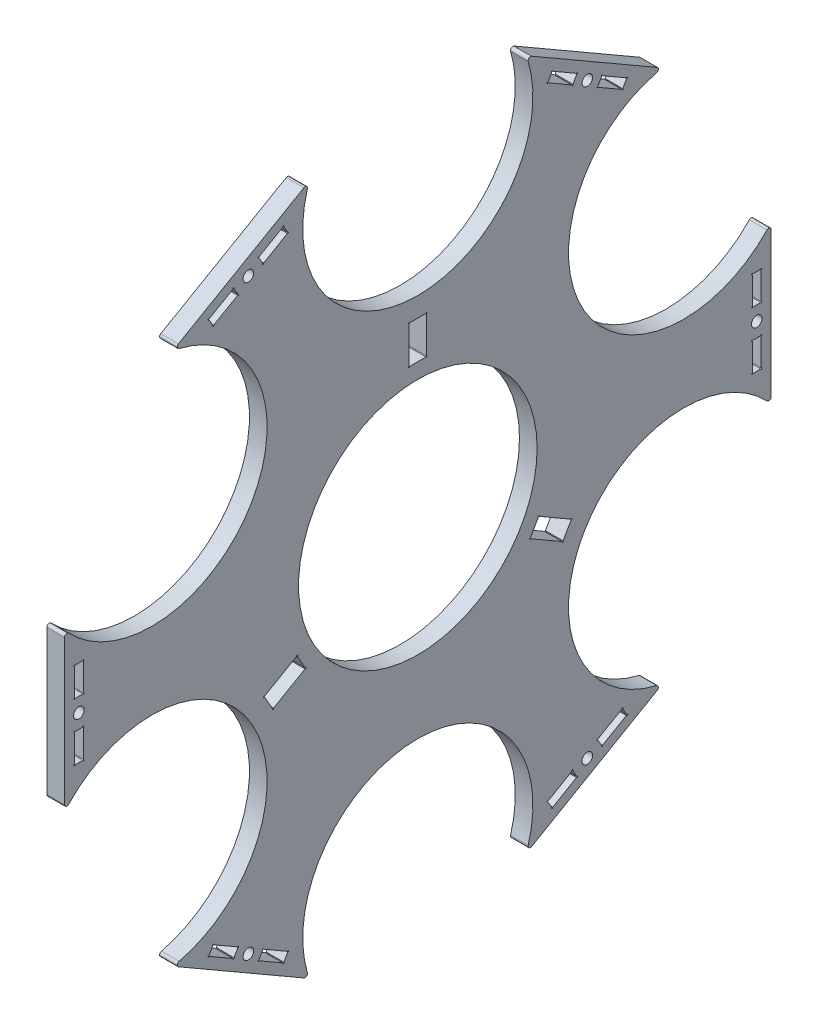
from build123d import *

# Parameters (mm, degrees)
SKETCH2_R           = 39.487475
BOSS_EXTRUDE1_DEPTH = 5.842
FILLET1_R           = 0.79375
SKETCH4_W           = 5.742
SKETCH4_H           = 12.5
CUT_EXTRUDE3_DEPTH  = 163.986308211
SKETCH5_R           = 0.1984375
CUT_EXTRUDE4_DEPTH  = 163.986308211
SKETCH6_R           = 1.7526
CUT_EXTRUDE5_DEPTH  = 163.986308211


with BuildPart() as part:
    # Sketch2 → Boss-Extrude1 (new body)
    with BuildSketch(Plane(origin=(0, 0, 0), x_dir=(0, 0, -1), z_dir=(1, 0, 0))):
        with BuildLine():
            ThreePointArc((116.947215895, 26.041480267), (54.99261314, 31.75), (81.02619141, 88.258519733))
            Line((81.02619141, 88.258519733), (35.921024484, 114.3))
            ThreePointArc((35.921024484, 114.3), (0, 63.5), (-35.921024484, 114.3))
            Line((-35.921024484, 114.3), (-81.02619141, 88.258519733))
            ThreePointArc((-81.02619141, 88.258519733), (-54.99261314, 31.75), (-116.947215895, 26.041480267))
            Line((-116.947215895, 26.041480267), (-116.947215895, -26.041480267))
            ThreePointArc((-116.947215895, -26.041480267), (-54.99261314, -31.75), (-81.02619141, -88.258519733))
            Line((-81.02619141, -88.258519733), (-35.921024484, -114.3))
            ThreePointArc((-35.921024484, -114.3), (0, -63.5), (35.921024484, -114.3))
            Line((35.921024484, -114.3), (81.02619141, -88.258519733))
            ThreePointArc((81.02619141, -88.258519733), (54.99261314, -31.75), (116.947215895, -26.041480267))
            Line((116.947215895, -26.041480267), (116.947215895, 26.041480267))
        make_face()
        Circle(SKETCH2_R, mode=Mode.SUBTRACT)
    extrude(amount=BOSS_EXTRUDE1_DEPTH)

    # Fillet1
    fillet1_edges = [part.edges().sort_by_distance(p)[0] for p in [
        (2.921, -114.3, 35.921024484),
        (2.921, -114.3, -35.921024484),
        (2.921, -88.258519733, -81.02619141),
        (2.921, -26.041480267, -116.947215895),
        (2.921, 88.258519733, -81.02619141),
        (2.921, 26.041480267, -116.947215895),
        (2.921, -88.258519733, 81.02619141),
        (2.921, -26.041480267, 116.947215895),
        (2.921, 26.041480267, 116.947215895),
        (2.921, 88.258519733, 81.02619141),
        (2.921, 114.3, -35.921024484),
        (2.921, 114.3, 35.921024484),
    ]]
    fillet(fillet1_edges, radius=FILLET1_R)

    # Sketch4 → Cut-Extrude3 (cut, through all)
    with BuildSketch(Plane(origin=(5.842, 0, 0), x_dir=(0, 0, -1), z_dir=(1, 0, 0))):
        Polygon((47.971249286, -31.011358934), (50.842249286, -26.038641066), (40.016931739, -19.788641066), (37.145931739, -24.761358934), align=None)
        with Locations((0, 50.8)):
            Rectangle(SKETCH4_W, SKETCH4_H)
        Polygon((-50.842249286, -26.038641066), (-47.971249286, -31.011358934), (-37.145931739, -24.761358934), (-40.016931739, -19.788641066), align=None)
    extrude(amount=-CUT_EXTRUDE3_DEPTH, mode=Mode.SUBTRACT)

    # Sketch5 → Cut-Extrude4 (cut, through all)
    with BuildSketch(Plane(origin=(5.842, 0, 0), x_dir=(0, 0, -1), z_dir=(1, 0, 0))):
        with Locations((2.871, 57.05)):
            Circle(SKETCH5_R)
        with Locations((-2.871, 57.05)):
            Circle(SKETCH5_R)
        with Locations((-2.871, 44.55)):
            Circle(SKETCH5_R)
        with Locations((2.871, 44.55)):
            Circle(SKETCH5_R)
        with Locations((47.971249286, -31.011358934)):
            Circle(SKETCH5_R)
        with Locations((50.842249286, -26.038641066)):
            Circle(SKETCH5_R)
        with Locations((40.016931739, -19.788641066)):
            Circle(SKETCH5_R)
        with Locations((37.145931739, -24.761358934)):
            Circle(SKETCH5_R)
        with Locations((-50.842249286, -26.038641066)):
            Circle(SKETCH5_R)
        with Locations((-47.971249286, -31.011358934)):
            Circle(SKETCH5_R)
        with Locations((-37.145931739, -24.761358934)):
            Circle(SKETCH5_R)
        with Locations((-40.016931739, -19.788641066)):
            Circle(SKETCH5_R)
    extrude(amount=-CUT_EXTRUDE4_DEPTH, mode=Mode.SUBTRACT)

    # Sketch6 → Cut-Extrude5 (cut, through all)
    with BuildSketch(Plane(origin=(5.842, 0, 0), x_dir=(0, 0, -1), z_dir=(1, 0, 0))):
        with Locations((-56.092357947, 97.154813881)):
            Circle(SKETCH6_R)
        with Locations((56.092357947, 97.154813881)):
            Circle(SKETCH6_R)
        with Locations((112.184715895, 0)):
            Circle(SKETCH6_R)
        with Locations((56.092357947, -97.154813881)):
            Circle(SKETCH6_R)
        with Locations((-56.092357947, -97.154813881)):
            Circle(SKETCH6_R)
        with Locations((-112.184715895, 0)):
            Circle(SKETCH6_R)
        with BuildLine():
            Line((-67.550093988, 88.822069843), (-59.644905849, 93.386132343))
            ThreePointArc((-59.644905849, 93.386132343), (-59.281378027, 93.433991689), (-59.572272683, 93.657203009))
            Line((-59.572272683, 93.657203009), (-60.861335183, 95.889924753))
            ThreePointArc((-60.861335183, 95.889924753), (-60.909194529, 96.253452575), (-61.132405849, 95.962557919))
            Line((-61.132405849, 95.962557919), (-69.037593988, 91.398495419))
            ThreePointArc((-69.037593988, 91.398495419), (-69.40112181, 91.350636074), (-69.110227154, 91.127424753))
            Line((-69.110227154, 91.127424753), (-67.821164654, 88.894703009))
            ThreePointArc((-67.821164654, 88.894703009), (-67.773305308, 88.531175187), (-67.550093988, 88.822069843))
        make_face()
        with BuildLine():
            Line((-44.634621907, 105.487557919), (-52.539810046, 100.923495419))
            ThreePointArc((-52.539810046, 100.923495419), (-52.903337868, 100.875636074), (-52.612443212, 100.652424753))
            Line((-52.612443212, 100.652424753), (-51.323380712, 98.419703009))
            ThreePointArc((-51.323380712, 98.419703009), (-51.275521366, 98.056175187), (-51.052310046, 98.347069843))
            Line((-51.052310046, 98.347069843), (-43.147121907, 102.911132343))
            ThreePointArc((-43.147121907, 102.911132343), (-42.783594085, 102.958991689), (-43.074488741, 103.182203009))
            Line((-43.074488741, 103.182203009), (-44.363551241, 105.414924753))
            ThreePointArc((-44.363551241, 105.414924753), (-44.411410587, 105.778452575), (-44.634621907, 105.487557919))
        make_face()
        with BuildLine():
            Line((43.147121907, 102.911132343), (51.052310046, 98.347069843))
            ThreePointArc((51.052310046, 98.347069843), (51.275521366, 98.056175187), (51.323380712, 98.419703009))
            Line((51.323380712, 98.419703009), (52.612443212, 100.652424753))
            ThreePointArc((52.612443212, 100.652424753), (52.903337868, 100.875636074), (52.539810046, 100.923495419))
            Line((52.539810046, 100.923495419), (44.634621907, 105.487557919))
            ThreePointArc((44.634621907, 105.487557919), (44.411410587, 105.778452575), (44.363551241, 105.414924753))
            Line((44.363551241, 105.414924753), (43.074488741, 103.182203009))
            ThreePointArc((43.074488741, 103.182203009), (42.783594085, 102.958991689), (43.147121907, 102.911132343))
        make_face()
        with BuildLine():
            Line((69.037593988, 91.398495419), (61.132405849, 95.962557919))
            ThreePointArc((61.132405849, 95.962557919), (60.909194529, 96.253452575), (60.861335183, 95.889924753))
            Line((60.861335183, 95.889924753), (59.572272683, 93.657203009))
            ThreePointArc((59.572272683, 93.657203009), (59.281378027, 93.433991689), (59.644905849, 93.386132343))
            Line((59.644905849, 93.386132343), (67.550093988, 88.822069843))
            ThreePointArc((67.550093988, 88.822069843), (67.773305308, 88.531175187), (67.821164654, 88.894703009))
            Line((67.821164654, 88.894703009), (69.110227154, 91.127424753))
            ThreePointArc((69.110227154, 91.127424753), (69.40112181, 91.350636074), (69.037593988, 91.398495419))
        make_face()
        with BuildLine():
            Line((110.697215895, 14.0890625), (110.697215895, 4.9609375))
            ThreePointArc((110.697215895, 4.9609375), (110.556899393, 4.622183498), (110.895653395, 4.7625))
            Line((110.895653395, 4.7625), (113.473778395, 4.7625))
            ThreePointArc((113.473778395, 4.7625), (113.812532397, 4.622183498), (113.672215895, 4.9609375))
            Line((113.672215895, 4.9609375), (113.672215895, 14.0890625))
            ThreePointArc((113.672215895, 14.0890625), (113.812532397, 14.427816502), (113.473778395, 14.2875))
            Line((113.473778395, 14.2875), (110.895653395, 14.2875))
            ThreePointArc((110.895653395, 14.2875), (110.556899393, 14.427816502), (110.697215895, 14.0890625))
        make_face()
        with BuildLine():
            Line((113.672215895, -14.0890625), (113.672215895, -4.9609375))
            ThreePointArc((113.672215895, -4.9609375), (113.812532397, -4.622183498), (113.473778395, -4.7625))
            Line((113.473778395, -4.7625), (110.895653395, -4.7625))
            ThreePointArc((110.895653395, -4.7625), (110.556899393, -4.622183498), (110.697215895, -4.9609375))
            Line((110.697215895, -4.9609375), (110.697215895, -14.0890625))
            ThreePointArc((110.697215895, -14.0890625), (110.556899393, -14.427816502), (110.895653395, -14.2875))
            Line((110.895653395, -14.2875), (113.473778395, -14.2875))
            ThreePointArc((113.473778395, -14.2875), (113.812532397, -14.427816502), (113.672215895, -14.0890625))
        make_face()
        with BuildLine():
            Line((67.550093988, -88.822069843), (59.644905849, -93.386132343))
            ThreePointArc((59.644905849, -93.386132343), (59.281378027, -93.433991689), (59.572272683, -93.657203009))
            Line((59.572272683, -93.657203009), (60.861335183, -95.889924753))
            ThreePointArc((60.861335183, -95.889924753), (60.909194529, -96.253452575), (61.132405849, -95.962557919))
            Line((61.132405849, -95.962557919), (69.037593988, -91.398495419))
            ThreePointArc((69.037593988, -91.398495419), (69.40112181, -91.350636074), (69.110227154, -91.127424753))
            Line((69.110227154, -91.127424753), (67.821164654, -88.894703009))
            ThreePointArc((67.821164654, -88.894703009), (67.773305308, -88.531175187), (67.550093988, -88.822069843))
        make_face()
        with BuildLine():
            Line((44.634621907, -105.487557919), (52.539810046, -100.923495419))
            ThreePointArc((52.539810046, -100.923495419), (52.903337868, -100.875636074), (52.612443212, -100.652424753))
            Line((52.612443212, -100.652424753), (51.323380712, -98.419703009))
            ThreePointArc((51.323380712, -98.419703009), (51.275521366, -98.056175187), (51.052310046, -98.347069843))
            Line((51.052310046, -98.347069843), (43.147121907, -102.911132343))
            ThreePointArc((43.147121907, -102.911132343), (42.783594085, -102.958991689), (43.074488741, -103.182203009))
            Line((43.074488741, -103.182203009), (44.363551241, -105.414924753))
            ThreePointArc((44.363551241, -105.414924753), (44.411410587, -105.778452575), (44.634621907, -105.487557919))
        make_face()
        with BuildLine():
            Line((-43.147121907, -102.911132343), (-51.052310046, -98.347069843))
            ThreePointArc((-51.052310046, -98.347069843), (-51.275521366, -98.056175187), (-51.323380712, -98.419703009))
            Line((-51.323380712, -98.419703009), (-52.612443212, -100.652424753))
            ThreePointArc((-52.612443212, -100.652424753), (-52.903337868, -100.875636074), (-52.539810046, -100.923495419))
            Line((-52.539810046, -100.923495419), (-44.634621907, -105.487557919))
            ThreePointArc((-44.634621907, -105.487557919), (-44.411410587, -105.778452575), (-44.363551241, -105.414924753))
            Line((-44.363551241, -105.414924753), (-43.074488741, -103.182203009))
            ThreePointArc((-43.074488741, -103.182203009), (-42.783594085, -102.958991689), (-43.147121907, -102.911132343))
        make_face()
        with BuildLine():
            Line((-69.037593988, -91.398495419), (-61.132405849, -95.962557919))
            ThreePointArc((-61.132405849, -95.962557919), (-60.909194529, -96.253452575), (-60.861335183, -95.889924753))
            Line((-60.861335183, -95.889924753), (-59.572272683, -93.657203009))
            ThreePointArc((-59.572272683, -93.657203009), (-59.281378027, -93.433991689), (-59.644905849, -93.386132343))
            Line((-59.644905849, -93.386132343), (-67.550093988, -88.822069843))
            ThreePointArc((-67.550093988, -88.822069843), (-67.773305308, -88.531175187), (-67.821164654, -88.894703009))
            Line((-67.821164654, -88.894703009), (-69.110227154, -91.127424753))
            ThreePointArc((-69.110227154, -91.127424753), (-69.40112181, -91.350636074), (-69.037593988, -91.398495419))
        make_face()
        with BuildLine():
            Line((-110.697215895, -14.0890625), (-110.697215895, -4.9609375))
            ThreePointArc((-110.697215895, -4.9609375), (-110.556899393, -4.622183498), (-110.895653395, -4.7625))
            Line((-110.895653395, -4.7625), (-113.473778395, -4.7625))
            ThreePointArc((-113.473778395, -4.7625), (-113.812532397, -4.622183498), (-113.672215895, -4.9609375))
            Line((-113.672215895, -4.9609375), (-113.672215895, -14.0890625))
            ThreePointArc((-113.672215895, -14.0890625), (-113.812532397, -14.427816502), (-113.473778395, -14.2875))
            Line((-113.473778395, -14.2875), (-110.895653395, -14.2875))
            ThreePointArc((-110.895653395, -14.2875), (-110.556899393, -14.427816502), (-110.697215895, -14.0890625))
        make_face()
        with BuildLine():
            Line((-113.672215895, 14.0890625), (-113.672215895, 4.9609375))
            ThreePointArc((-113.672215895, 4.9609375), (-113.812532397, 4.622183498), (-113.473778395, 4.7625))
            Line((-113.473778395, 4.7625), (-110.895653395, 4.7625))
            ThreePointArc((-110.895653395, 4.7625), (-110.556899393, 4.622183498), (-110.697215895, 4.9609375))
            Line((-110.697215895, 4.9609375), (-110.697215895, 14.0890625))
            ThreePointArc((-110.697215895, 14.0890625), (-110.556899393, 14.427816502), (-110.895653395, 14.2875))
            Line((-110.895653395, 14.2875), (-113.473778395, 14.2875))
            ThreePointArc((-113.473778395, 14.2875), (-113.812532397, 14.427816502), (-113.672215895, 14.0890625))
        make_face()
    extrude(amount=-CUT_EXTRUDE5_DEPTH, mode=Mode.SUBTRACT)


solid = part.part
